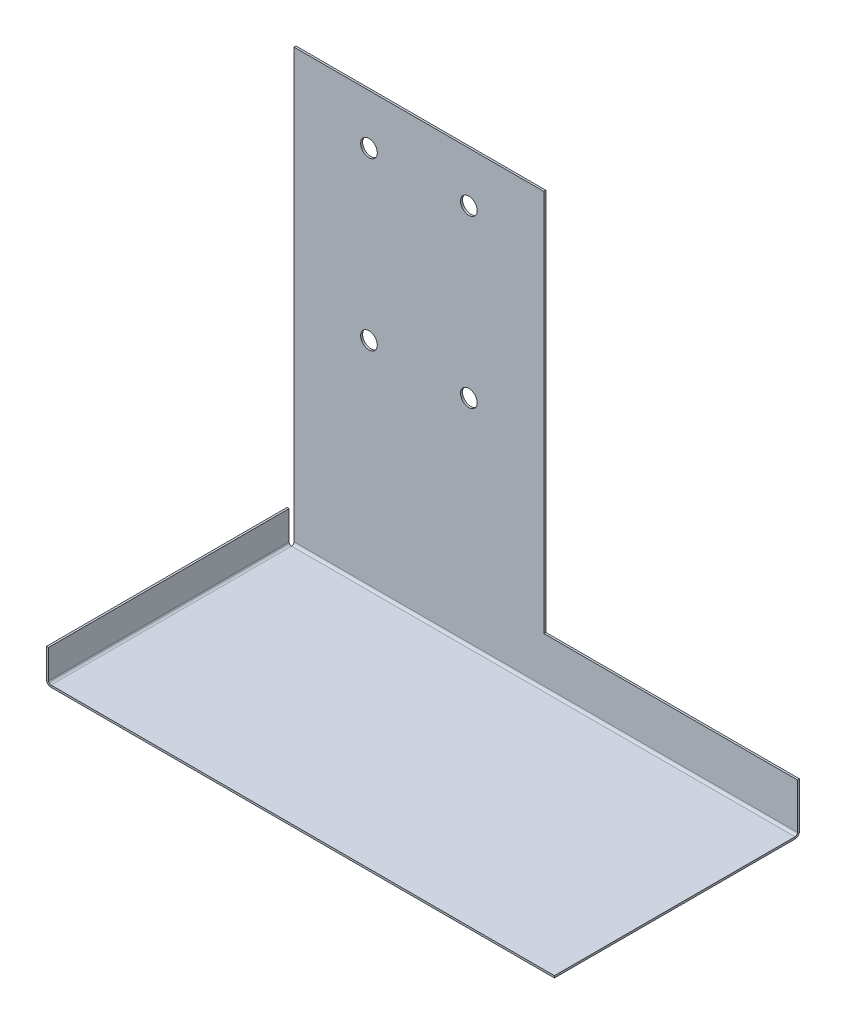
from build123d import *

# Parameters (mm, degrees)
SKETCH2_W                    = 75
SKETCH2_H                    = 130
BASE_FLANGE1_DEPTH           = 0.6
TAB2_START                   = -0.6
TAB2_OUTLINE_W               = 76.2
TAB2_OUTLINE_H               = 15
TAB2_DEPTH                   = 0.6
CUT_EXTRUDE1_REACH           = 201.404
SKETCH10_R                   = 2.5
EDGE_FLANGE1_STRIP_W         = 3.8732
EDGE_FLANGE1_STRIP_H         = 0.6
EDGE_FLANGE1_STRIP_CUT_DEPTH = 151.2
EDGE_FLANGE1_DEPTH           = 151.2
EDGE_FLANGE2_DEPTH           = 72.2634


# Read off the part's stored shape, not the designer's step: Tab2
# Sheet-metal steps are written as plain solids
with BuildPart() as part:
    # Sketch2 → Base-Flange1 (new body)
    with BuildSketch(Plane.XY):
        with Locations((37.5, 65)):
            Rectangle(SKETCH2_W, SKETCH2_H)
    extrude(amount=-BASE_FLANGE1_DEPTH)

    # Tab2 outline → Tab2 (add)
    with BuildSketch(Plane.XY.offset(TAB2_START)):
        with Locations((113.1, 7.5)):
            Rectangle(TAB2_OUTLINE_W, TAB2_OUTLINE_H)
    extrude(amount=TAB2_DEPTH)

    # Sketch10 → Cut-Extrude1 (cut, up to next)
    with BuildSketch(Plane(origin=(0, 0, -0.6), x_dir=(-1, 0, 0), z_dir=(0, 0, -1)), mode=Mode.PRIVATE) as cut_extrude1_sk1:
        with Locations((-22.5, 65)):
            Circle(SKETCH10_R)
    cut_extrude1_tool1 = extrude(cut_extrude1_sk1.sketch, amount=-CUT_EXTRUDE1_REACH, mode=Mode.PRIVATE) & part.part
    # Sketch10 → Cut-Extrude1 (cut, up to next)
    with BuildSketch(Plane(origin=(0, 0, -0.6), x_dir=(-1, 0, 0), z_dir=(0, 0, -1)), mode=Mode.PRIVATE) as cut_extrude1_sk2:
        with Locations((-52.5, 115)):
            Circle(SKETCH10_R)
    cut_extrude1_tool2 = extrude(cut_extrude1_sk2.sketch, amount=-CUT_EXTRUDE1_REACH, mode=Mode.PRIVATE) & part.part
    # Sketch10 → Cut-Extrude1 (cut, up to next)
    with BuildSketch(Plane(origin=(0, 0, -0.6), x_dir=(-1, 0, 0), z_dir=(0, 0, -1)), mode=Mode.PRIVATE) as cut_extrude1_sk3:
        with Locations((-52.5, 65)):
            Circle(SKETCH10_R)
    cut_extrude1_tool3 = extrude(cut_extrude1_sk3.sketch, amount=-CUT_EXTRUDE1_REACH, mode=Mode.PRIVATE) & part.part
    # Sketch10 → Cut-Extrude1 (cut, up to next)
    with BuildSketch(Plane(origin=(0, 0, -0.6), x_dir=(-1, 0, 0), z_dir=(0, 0, -1)), mode=Mode.PRIVATE) as cut_extrude1_sk4:
        with Locations((-22.5, 115)):
            Circle(SKETCH10_R)
    cut_extrude1_tool4 = extrude(cut_extrude1_sk4.sketch, amount=-CUT_EXTRUDE1_REACH, mode=Mode.PRIVATE) & part.part
    add(cut_extrude1_tool1.solids().sort_by_distance((22.5, 65, -0.6))[0], mode=Mode.SUBTRACT)
    add(cut_extrude1_tool2.solids().sort_by_distance((52.5, 115, -0.6))[0], mode=Mode.SUBTRACT)
    add(cut_extrude1_tool3.solids().sort_by_distance((52.5, 65, -0.6))[0], mode=Mode.SUBTRACT)
    add(cut_extrude1_tool4.solids().sort_by_distance((22.5, 115, -0.6))[0], mode=Mode.SUBTRACT)

    # Edge-Flange1 strip (across the edge) → Edge-Flange1 strip cut (cut)
    with BuildSketch(Plane.YZ):
        with Locations((-0.6, -0.3)):
            Rectangle(EDGE_FLANGE1_STRIP_W, EDGE_FLANGE1_STRIP_H)
    extrude(amount=EDGE_FLANGE1_STRIP_CUT_DEPTH, mode=Mode.SUBTRACT)

    # Edge-Flange1 section (across the edge) → Edge-Flange1 (add)
    with BuildSketch(Plane.YZ):
        with BuildLine():
            Line((0, 0.7366), (0, 73))
            Line((0, 73), (0.6, 73))
            Line((0.6, 73), (0.6, 0.7366))
            ThreePointArc((0.6, 0.7366), (0.815745145, 0.215745145), (1.3366, 0))
            Line((1.3366, 0), (1.3366, -0.6))
            ThreePointArc((1.3366, -0.6), (0.391481076, -0.208518924), (0, 0.7366))
        make_face()
    extrude(amount=EDGE_FLANGE1_DEPTH)

    # Edge-Flange2 section (across the edge) → Edge-Flange2 (add)
    with BuildSketch(Plane(origin=(-0.7366, 0.6, 0.7366), x_dir=(1, 0, 0), z_dir=(0, 0, 1))):
        with BuildLine():
            Line((-0.6, 0.7366), (-0.6, 9.4))
            Line((-0.6, 9.4), (0, 9.4))
            Line((0, 9.4), (0, 0.7366))
            ThreePointArc((0, 0.7366), (0.215745145, 0.215745145), (0.7366, 0))
            Line((0.7366, 0), (0.7366, -0.6))
            ThreePointArc((0.7366, -0.6), (-0.208518924, -0.208518924), (-0.6, 0.7366))
        make_face()
    extrude(amount=EDGE_FLANGE2_DEPTH)


solid = part.part
